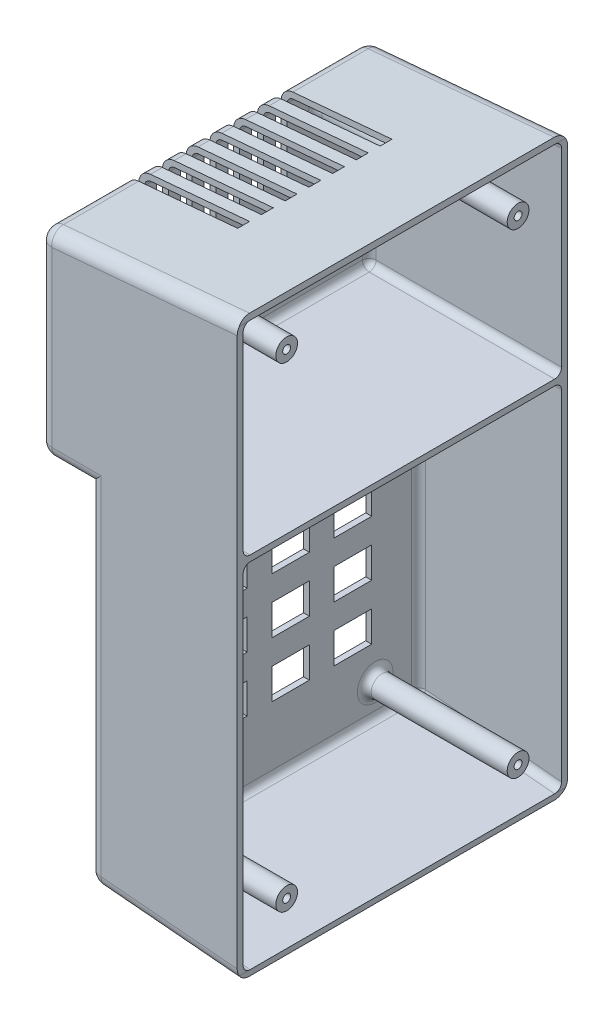
from build123d import *

# Parameters (mm, degrees)
BOSS_EXTRUDE1_DEPTH = 84.836
BOSS_EXTRUDE3_REACH = 154.288
SKETCH2_W           = 1.524
SKETCH2_H           = 147.477742188
CUT_EXTRUDE1_DEPTH  = 84.836
BOSS_EXTRUDE4_REACH = 154.288
SKETCH2_5_W         = 1.524
SKETCH2_5_H         = 147.477742188
CUT_EXTRUDE2_DEPTH  = 137.922
SKETCH5_R           = 2.794
SKETCH5_R_2         = 1.016
BOSS_EXTRUDE5_DEPTH = 36.708825352
SKETCH4_R           = 2.794
SKETCH4_R_2         = 1.016
BOSS_EXTRUDE6_DEPTH = 49.408825352
SKETCH6_W           = 9.652
SKETCH6_H           = 7.874
CUT_EXTRUDE3_DEPTH  = 137.922
FILLET1_R           = 3.302
FILLET2_R           = 1.778
SKETCH7_W           = 3.048
SKETCH7_H           = 35.859700712
CUT_EXTRUDE4_DEPTH  = 28.448


with BuildPart() as part:
    # Sketch1 → Boss-Extrude1 (new body)
    with BuildSketch(Plane.XY):
        Polygon((8.050273224, 31.718194599), (-42.749726776, 27.273770492), (-42.749726776, -23.526229508), (-30.049726776, -23.526229508), (-30.049726776, -112.426229508), (8.050273224, -115.759547589), (8.183098576, -114.241346869), (-28.525726776, -111.029740799), (-28.525726776, -23.526229508), (8.183098576, -23.526229508), (8.183098576, -22.002229508), (-28.525726776, -22.002229508), (-41.225726776, -22.002229508), (-41.225726776, 25.877281783), (8.183098576, 30.199993879), align=None)
    extrude(amount=BOSS_EXTRUDE1_DEPTH)

    # Boss-Extrude3: up to this face of the body (flat: up to its plane)
    boss_extrude3_end = Plane(part.part.faces().sort_by_distance((-41.225726776, 1.937526137, 42.418))[0])
    # Sketch2 → Boss-Extrude3 (add, up to the picked face)
    with BuildSketch(Plane(origin=(8.183098576, 0, 0), x_dir=(0, 0, -1), z_dir=(1, 0, 0)), mode=Mode.PRIVATE) as boss_extrude3_sk1:
        with Locations((-84.074, -42.020676495)):
            Rectangle(SKETCH2_W, SKETCH2_H)
    boss_extrude3_tool1 = split(extrude(boss_extrude3_sk1.sketch, amount=-BOSS_EXTRUDE3_REACH, mode=Mode.PRIVATE), bisect_by=boss_extrude3_end, keep=Keep.BOTH, mode=Mode.PRIVATE)
    add(boss_extrude3_tool1.solids().sort_by(Axis((8.183099, -42.020676, 84.074), (-1, 0, 0)))[0])

    # Sketch3 → Cut-Extrude1 (cut)
    with BuildSketch(Plane(origin=(0, 0, 83.312), x_dir=(-1, 0, 0), z_dir=(0, 0, -1))):
        Polygon((-8.050273224, -115.759547589), (30.049726776, -112.426229508), (30.049726776, -23.526229508), (42.749726776, -23.526229508), (42.749726776, 27.273770492), (-8.050273224, 31.718194599), (-8.183098576, 30.199993879), (-14.157128219, 30.722653748), (-14.157128219, 64.896442965), (63.943288286, 64.896442965), (63.943288286, -137.07668363), (-11.695133828, -137.07668363), (-11.695133828, -114.092888548), (-8.183098576, -114.241346869), align=None)
    extrude(amount=-CUT_EXTRUDE1_DEPTH, mode=Mode.SUBTRACT)

    # Boss-Extrude4: up to this face of the body (flat: up to its plane)
    boss_extrude4_end = Plane(part.part.faces().sort_by_distance((-41.225726776, 1.937526137, 41.656))[0])
    # Sketch2<5> → Boss-Extrude4 (add, up to the picked face)
    with BuildSketch(Plane(origin=(8.183098576, 0, 0), x_dir=(0, 0, -1), z_dir=(1, 0, 0)), mode=Mode.PRIVATE) as boss_extrude4_sk1:
        with Locations((-0.762, -42.020676495)):
            Rectangle(SKETCH2_5_W, SKETCH2_5_H)
    boss_extrude4_tool1 = split(extrude(boss_extrude4_sk1.sketch, amount=-BOSS_EXTRUDE4_REACH, mode=Mode.PRIVATE), bisect_by=boss_extrude4_end, keep=Keep.BOTH, mode=Mode.PRIVATE)
    add(boss_extrude4_tool1.solids().sort_by(Axis((8.183099, -42.020676, 0.762), (-1, 0, 0)))[0])

    # Sketch3<2> → Cut-Extrude2 (cut)
    with BuildSketch(Plane(origin=(0, 0, 83.312), x_dir=(-1, 0, 0), z_dir=(0, 0, -1))):
        Polygon((-8.050273224, -115.759547589), (30.049726776, -112.426229508), (30.049726776, -23.526229508), (42.749726776, -23.526229508), (42.749726776, 27.273770492), (-8.050273224, 31.718194599), (-8.183098576, 30.199993879), (-14.157128219, 30.722653748), (-14.157128219, 64.896442965), (63.943288286, 64.896442965), (63.943288286, -137.07668363), (-11.695133828, -137.07668363), (-11.695133828, -114.092888548), (-8.183098576, -114.241346869), align=None)
    extrude(amount=CUT_EXTRUDE2_DEPTH, mode=Mode.SUBTRACT)

    # Sketch5 → Boss-Extrude5 (add)
    # profile 1 of 2: a face of its own
    with BuildSketch(Plane(origin=(-28.525726776, 0, 0), x_dir=(0, 0, -1), z_dir=(1, 0, 0))):
        with Locations(Location((-72.136, -103.059547589, 0), (0, 0, 180))):
            Circle(SKETCH5_R)
        with Locations(Location((-72.136, -103.059547589, 0), (0, 0, 180))):
            Circle(SKETCH5_R_2, mode=Mode.SUBTRACT)
    # profile 2 of 2: a face of its own
    with BuildSketch(Plane(origin=(-28.525726776, 0, 0), x_dir=(0, 0, -1), z_dir=(1, 0, 0))):
        with Locations(Location((-12.7, -103.059547589, 0), (0, 0, 180))):
            Circle(SKETCH5_R)
        with Locations(Location((-12.7, -103.059547589, 0), (0, 0, 180))):
            Circle(SKETCH5_R_2, mode=Mode.SUBTRACT)
    extrude(amount=BOSS_EXTRUDE5_DEPTH)

    # Sketch4 → Boss-Extrude6 (add)
    # profile 1 of 2: a face of its own
    with BuildSketch(Plane(origin=(-41.225726776, 0, 0), x_dir=(0, 0, -1), z_dir=(1, 0, 0))):
        with Locations(Location((-12.7, 19.018194599, 0), (0, 0, 180))):
            Circle(SKETCH4_R)
        with Locations(Location((-12.7, 19.018194599, 0), (0, 0, 180))):
            Circle(SKETCH4_R_2, mode=Mode.SUBTRACT)
    # profile 2 of 2: a face of its own
    with BuildSketch(Plane(origin=(-41.225726776, 0, 0), x_dir=(0, 0, -1), z_dir=(1, 0, 0))):
        with Locations(Location((-72.136, 19.018194599, 0), (0, 0, 180))):
            Circle(SKETCH4_R)
        with Locations(Location((-72.136, 19.018194599, 0), (0, 0, 180))):
            Circle(SKETCH4_R_2, mode=Mode.SUBTRACT)
    extrude(amount=BOSS_EXTRUDE6_DEPTH)

    # Sketch6 → Cut-Extrude3 (cut)
    with BuildSketch(Plane(origin=(-28.525726776, 0, 0), x_dir=(0, 0, -1), z_dir=(1, 0, 0))):
        with Locations((-50.419, -90.232547589)):
            Rectangle(SKETCH6_W, SKETCH6_H)
        with Locations((-34.417, -90.232547589)):
            Rectangle(SKETCH6_W, SKETCH6_H)
        with Locations((-18.415, -90.232547589)):
            Rectangle(SKETCH6_W, SKETCH6_H)
        with Locations((-34.417, -76.008547589)):
            Rectangle(SKETCH6_W, SKETCH6_H)
        with Locations((-18.415, -76.008547589)):
            Rectangle(SKETCH6_W, SKETCH6_H)
        with Locations((-34.417, -61.784547589)):
            Rectangle(SKETCH6_W, SKETCH6_H)
        with Locations((-18.415, -61.784547589)):
            Rectangle(SKETCH6_W, SKETCH6_H)
        with Locations((-50.419, -76.008547589)):
            Rectangle(SKETCH6_W, SKETCH6_H)
        with Locations((-50.419, -61.784547589)):
            Rectangle(SKETCH6_W, SKETCH6_H)
        with Locations((-66.421, -90.232547589)):
            Rectangle(SKETCH6_W, SKETCH6_H)
        with Locations((-66.421, -76.008547589)):
            Rectangle(SKETCH6_W, SKETCH6_H)
        with Locations((-66.421, -61.784547589)):
            Rectangle(SKETCH6_W, SKETCH6_H)
    extrude(amount=-CUT_EXTRUDE3_DEPTH, mode=Mode.SUBTRACT)

    # Fillet1
    # the kernel refuses this fillet: 3.302 mm, written as the material it takes off along each edge
    with BuildSketch(Plane(origin=(-39.447726776, 24.248044955, 3.302), x_dir=(-1, 0, 0), z_dir=(0, 0, -1))) as fillet1_piece_1_section:
        Polygon((0, 0), (FILLET1_R * 1.02, 0), (FILLET1_R * 1.02, FILLET1_R * 0.934657797498), (FILLET1_R * 0.0888988576026, FILLET1_R * 1.01611859205), align=None)
    fillet1_piece_1 = extrude(amount=FILLET1_R * 1.02, mode=Mode.PRIVATE)
    fillet1_piece_1 = fillet1_piece_1 - Plane(origin=(-39.447726776, 24.248044955, 3.302), x_dir=(0.7372773368101218, -0.6755902076156627, 0), z_dir=(0, 0, -1)) * Sphere(FILLET1_R, mode=Mode.PRIVATE)
    add(fillet1_piece_1, mode=Mode.SUBTRACT)
    with BuildSketch(Plane(origin=(-26.747726776, -109.400503972, 3.302), x_dir=(-0.08715574274765817, -0.9961946980917455, 0), z_dir=(0, 0, -1))) as fillet1_piece_2_section:
        Polygon((0, 0), (FILLET1_R * 1.02, 0), (FILLET1_R * 1.02, FILLET1_R * 0.934657797498), (FILLET1_R * 0.0888988576026, FILLET1_R * 1.01611859205), align=None)
    fillet1_piece_2 = extrude(amount=FILLET1_R * 1.02, mode=Mode.PRIVATE)
    fillet1_piece_2 = fillet1_piece_2 - Plane(origin=(-26.747726776, -109.400503972, 3.302), x_dir=(0.737277336810124, 0.6755902076156602, 0), z_dir=(0, 0, -1)) * Sphere(FILLET1_R, mode=Mode.PRIVATE)
    add(fillet1_piece_2, mode=Mode.SUBTRACT)
    with BuildSketch(Plane(origin=(-26.747726776, -109.400503972, 81.534), x_dir=(-0.08715574274765817, -0.9961946980917455, 0), z_dir=(0, 0, 1))) as fillet1_piece_3_section:
        Polygon((0, 0), (FILLET1_R * 1.02, 0), (FILLET1_R * 1.02, -FILLET1_R * 0.934657797498), (FILLET1_R * 0.0888988576026, -FILLET1_R * 1.01611859205), align=None)
    fillet1_piece_3 = extrude(amount=FILLET1_R * 1.02, mode=Mode.PRIVATE)
    fillet1_piece_3 = fillet1_piece_3 - Plane(origin=(-26.747726776, -109.400503972, 81.534), x_dir=(0.737277336810124, 0.6755902076156602, 0), z_dir=(0, 0, 1)) * Sphere(FILLET1_R, mode=Mode.PRIVATE)
    add(fillet1_piece_3, mode=Mode.SUBTRACT)
    with BuildSketch(Plane(origin=(-39.447726776, -20.224229508, 3.302), x_dir=(0, 0, -1), z_dir=(0, -1, 0))) as fillet1_piece_4_section:
        Polygon((0, 0), (FILLET1_R * 1.02, 0), (FILLET1_R * 1.02, -FILLET1_R * 1.02), (0, -FILLET1_R * 1.02), align=None)
    fillet1_piece_4 = extrude(amount=FILLET1_R * 1.02, mode=Mode.PRIVATE)
    fillet1_piece_4 = fillet1_piece_4 - Plane(origin=(-39.447726776, -20.224229508, 3.302), x_dir=(0.7071067811865475, 0, 0.7071067811865475), z_dir=(0, -1, 0)) * Sphere(FILLET1_R, mode=Mode.PRIVATE)
    add(fillet1_piece_4, mode=Mode.SUBTRACT)
    with BuildSketch(Plane(origin=(-39.447726776, -20.224229508, 81.534), x_dir=(-1, 0, 0), z_dir=(0, -1, 0))) as fillet1_piece_5_section:
        Polygon((0, 0), (FILLET1_R * 1.02, 0), (FILLET1_R * 1.02, -FILLET1_R * 1.02), (0, -FILLET1_R * 1.02), align=None)
    fillet1_piece_5 = extrude(amount=FILLET1_R * 1.02, mode=Mode.PRIVATE)
    fillet1_piece_5 = fillet1_piece_5 - Plane(origin=(-39.447726776, -20.224229508, 81.534), x_dir=(0.7071067811865475, 0, -0.7071067811865475), z_dir=(0, -1, 0)) * Sphere(FILLET1_R, mode=Mode.PRIVATE)
    add(fillet1_piece_5, mode=Mode.SUBTRACT)
    with BuildSketch(Plane(origin=(-39.447726776, 24.248044955, 81.534), x_dir=(-1, 0, 0), z_dir=(0, 0, 1))) as fillet1_piece_6_section:
        Polygon((0, 0), (FILLET1_R * 1.02, 0), (FILLET1_R * 1.02, -FILLET1_R * 0.934657797498), (FILLET1_R * 0.0888988576026, -FILLET1_R * 1.01611859205), align=None)
    fillet1_piece_6 = extrude(amount=FILLET1_R * 1.02, mode=Mode.PRIVATE)
    fillet1_piece_6 = fillet1_piece_6 - Plane(origin=(-39.447726776, 24.248044955, 81.534), x_dir=(0.7372773368101218, -0.6755902076156627, 0), z_dir=(0, 0, 1)) * Sphere(FILLET1_R, mode=Mode.PRIVATE)
    add(fillet1_piece_6, mode=Mode.SUBTRACT)
    with BuildSketch(Plane(origin=(8.050273224, 31.718194599, 0), x_dir=(0, 0, 1), z_dir=(-0.9961946980917461, -0.08715574274765156, 0)), Plane(origin=(-39.735515039, 27.537479848, 84.836), x_dir=(0, 0, -1), z_dir=(0.9961946980917461, 0.08715574274765149, 0))) as fillet1_piece_7:
        with BuildLine():
            CenterArc((FILLET1_R, -FILLET1_R), FILLET1_R, 90, 90)
            Line((0, -FILLET1_R), (-FILLET1_R * 0.02, -FILLET1_R))
            Line((-FILLET1_R * 0.02, -FILLET1_R), (-FILLET1_R * 0.02, FILLET1_R * 0.02))
            Line((-FILLET1_R * 0.02, FILLET1_R * 0.02), (FILLET1_R, FILLET1_R * 0.02))
            Line((FILLET1_R, FILLET1_R * 0.02), (FILLET1_R, 0))
        make_face()
    extrude(amount=47.968322211, mode=Mode.SUBTRACT)
    with BuildSketch(Plane(origin=(8.050273224, -115.759547589, 0), x_dir=(0.08715574274765817, 0.9961946980917454, 0), z_dir=(-0.9961946980917455, 0.08715574274765817, 0))) as fillet1_piece_8:
        with BuildLine():
            CenterArc((FILLET1_R, -FILLET1_R), FILLET1_R, 90, 90)
            Line((0, -FILLET1_R), (-FILLET1_R * 0.02, -FILLET1_R))
            Line((-FILLET1_R * 0.02, -FILLET1_R), (-FILLET1_R * 0.02, FILLET1_R * 0.02))
            Line((-FILLET1_R * 0.02, FILLET1_R * 0.02), (FILLET1_R, FILLET1_R * 0.02))
            Line((FILLET1_R, FILLET1_R * 0.02), (FILLET1_R, 0))
        make_face()
    extrude(amount=35.219810274, mode=Mode.SUBTRACT)
    with BuildSketch(Plane(origin=(8.050273224, -115.759547589, 84.836), x_dir=(0.08715574274765817, 0.9961946980917457, -4.303711300788011e-15), z_dir=(-0.9961946980917455, 0.08715574274765817, 0))) as fillet1_piece_9:
        with BuildLine():
            CenterArc((FILLET1_R, FILLET1_R), FILLET1_R, 180, 90)
            Line((0, FILLET1_R), (-FILLET1_R * 0.02, FILLET1_R))
            Line((-FILLET1_R * 0.02, FILLET1_R), (-FILLET1_R * 0.02, -FILLET1_R * 0.02))
            Line((-FILLET1_R * 0.02, -FILLET1_R * 0.02), (FILLET1_R, -FILLET1_R * 0.02))
            Line((FILLET1_R, -FILLET1_R * 0.02), (FILLET1_R, 0))
        make_face()
    extrude(amount=35.219810274, mode=Mode.SUBTRACT)
    with BuildSketch(Plane(origin=(-30.049726776, -112.426229508, 81.534), x_dir=(0.9961946980917457, -0.08715574274765692, 0), z_dir=(0, 0, -1)), Plane(origin=(-42.749726776, 27.273770492, 3.302), x_dir=(0.9961946980917461, 0.08715574274765134, 0), z_dir=(0, 0, 1))) as fillet1_piece_10:
        with BuildLine():
            CenterArc((FILLET1_R * 0.916331174017, -FILLET1_R), FILLET1_R, 90, 85)
            Line((-FILLET1_R * 0.0798635240743, -FILLET1_R * 0.912844257252), (-FILLET1_R * 0.0997874180362, -FILLET1_R * 0.911101142397))
            Line((-FILLET1_R * 0.0997874180362, -FILLET1_R * 0.911101142397), (-FILLET1_R * 0.0183266234803, FILLET1_R * 0.02))
            Line((-FILLET1_R * 0.0183266234803, FILLET1_R * 0.02), (FILLET1_R * 0.916331174017, FILLET1_R * 0.02))
            Line((FILLET1_R * 0.916331174017, FILLET1_R * 0.02), (FILLET1_R * 0.916331174017, 0))
        make_face()
    extrude(amount=78.232, mode=Mode.SUBTRACT)
    with BuildSketch(Plane(origin=(-30.049726776, -109.400503972, 0), x_dir=(1, 0, 0), z_dir=(0, 1, 0))) as fillet1_piece_11:
        with BuildLine():
            CenterArc((FILLET1_R, -FILLET1_R), FILLET1_R, 90, 90)
            Line((0, -FILLET1_R), (-FILLET1_R * 0.02, -FILLET1_R))
            Line((-FILLET1_R * 0.02, -FILLET1_R), (-FILLET1_R * 0.02, FILLET1_R * 0.02))
            Line((-FILLET1_R * 0.02, FILLET1_R * 0.02), (FILLET1_R, FILLET1_R * 0.02))
            Line((FILLET1_R, FILLET1_R * 0.02), (FILLET1_R, 0))
        make_face()
    extrude(amount=85.874274463, mode=Mode.SUBTRACT)
    with BuildSketch(Plane(origin=(-39.447726776, -23.526229508, 0), x_dir=(0, 1, 0), z_dir=(1, 0, 0))) as fillet1_piece_12:
        with BuildLine():
            CenterArc((FILLET1_R, FILLET1_R), FILLET1_R, 180, 90)
            Line((0, FILLET1_R), (-FILLET1_R * 0.02, FILLET1_R))
            Line((-FILLET1_R * 0.02, FILLET1_R), (-FILLET1_R * 0.02, -FILLET1_R * 0.02))
            Line((-FILLET1_R * 0.02, -FILLET1_R * 0.02), (FILLET1_R, -FILLET1_R * 0.02))
            Line((FILLET1_R, -FILLET1_R * 0.02), (FILLET1_R, 0))
        make_face()
    extrude(amount=9.398, mode=Mode.SUBTRACT)
    with BuildSketch(Plane(origin=(-42.749726776, 24.248044955, 0), x_dir=(1, 0, 0), z_dir=(0, -1, 0))) as fillet1_piece_13:
        with BuildLine():
            CenterArc((FILLET1_R, FILLET1_R), FILLET1_R, 180, 90)
            Line((0, FILLET1_R), (-FILLET1_R * 0.02, FILLET1_R))
            Line((-FILLET1_R * 0.02, FILLET1_R), (-FILLET1_R * 0.02, -FILLET1_R * 0.02))
            Line((-FILLET1_R * 0.02, -FILLET1_R * 0.02), (FILLET1_R, -FILLET1_R * 0.02))
            Line((FILLET1_R, -FILLET1_R * 0.02), (FILLET1_R, 0))
        make_face()
    extrude(amount=44.472274463, mode=Mode.SUBTRACT)
    with BuildSketch(Plane(origin=(-42.749726776, -23.526229508, 3.302), x_dir=(0, 1, 0), z_dir=(0, 0, 1))) as fillet1_piece_14:
        with BuildLine():
            CenterArc((FILLET1_R, -FILLET1_R), FILLET1_R, 90, 90)
            Line((0, -FILLET1_R), (-FILLET1_R * 0.02, -FILLET1_R))
            Line((-FILLET1_R * 0.02, -FILLET1_R), (-FILLET1_R * 0.02, FILLET1_R * 0.02))
            Line((-FILLET1_R * 0.02, FILLET1_R * 0.02), (FILLET1_R, FILLET1_R * 0.02))
            Line((FILLET1_R, FILLET1_R * 0.02), (FILLET1_R, 0))
        make_face()
    extrude(amount=78.232, mode=Mode.SUBTRACT)
    with BuildSketch(Plane(origin=(-39.447726776, -23.526229508, 84.836), x_dir=(0, 1, 0), z_dir=(1, 0, 0))) as fillet1_piece_15:
        with BuildLine():
            CenterArc((FILLET1_R, -FILLET1_R), FILLET1_R, 90, 90)
            Line((0, -FILLET1_R), (-FILLET1_R * 0.02, -FILLET1_R))
            Line((-FILLET1_R * 0.02, -FILLET1_R), (-FILLET1_R * 0.02, FILLET1_R * 0.02))
            Line((-FILLET1_R * 0.02, FILLET1_R * 0.02), (FILLET1_R, FILLET1_R * 0.02))
            Line((FILLET1_R, FILLET1_R * 0.02), (FILLET1_R, 0))
        make_face()
    extrude(amount=9.398, mode=Mode.SUBTRACT)
    with BuildSketch(Plane(origin=(-30.049726776, -109.400503972, 84.836), x_dir=(1, 0, 0), z_dir=(0, 1, 0))) as fillet1_piece_16:
        with BuildLine():
            CenterArc((FILLET1_R, FILLET1_R), FILLET1_R, 180, 90)
            Line((0, FILLET1_R), (-FILLET1_R * 0.02, FILLET1_R))
            Line((-FILLET1_R * 0.02, FILLET1_R), (-FILLET1_R * 0.02, -FILLET1_R * 0.02))
            Line((-FILLET1_R * 0.02, -FILLET1_R * 0.02), (FILLET1_R, -FILLET1_R * 0.02))
            Line((FILLET1_R, -FILLET1_R * 0.02), (FILLET1_R, 0))
        make_face()
    extrude(amount=85.874274463, mode=Mode.SUBTRACT)
    with BuildSketch(Plane(origin=(-42.749726776, 24.248044955, 84.836), x_dir=(1, 0, 0), z_dir=(0, -1, 0))) as fillet1_piece_17:
        with BuildLine():
            CenterArc((FILLET1_R, -FILLET1_R), FILLET1_R, 90, 90)
            Line((0, -FILLET1_R), (-FILLET1_R * 0.02, -FILLET1_R))
            Line((-FILLET1_R * 0.02, -FILLET1_R), (-FILLET1_R * 0.02, FILLET1_R * 0.02))
            Line((-FILLET1_R * 0.02, FILLET1_R * 0.02), (FILLET1_R, FILLET1_R * 0.02))
            Line((FILLET1_R, FILLET1_R * 0.02), (FILLET1_R, 0))
        make_face()
    extrude(amount=44.472274463, mode=Mode.SUBTRACT)
    with BuildSketch(Plane(origin=(-39.447726776, -23.526229508, 0), x_dir=(0, 1, 0), z_dir=(1, 0, 0))) as fillet1_piece_18a_section:
        with BuildLine():
            CenterArc((FILLET1_R, FILLET1_R), FILLET1_R, 180, 90)
            Line((0, FILLET1_R), (-FILLET1_R * 0.02, FILLET1_R))
            Line((-FILLET1_R * 0.02, FILLET1_R), (-FILLET1_R * 0.02, -FILLET1_R * 0.02))
            Line((-FILLET1_R * 0.02, -FILLET1_R * 0.02), (FILLET1_R, -FILLET1_R * 0.02))
            Line((FILLET1_R, -FILLET1_R * 0.02), (FILLET1_R, 0))
        make_face()
    fillet1_piece_18a = extrude(amount=17.653, mode=Mode.PRIVATE)
    fillet1_piece_18a = split(fillet1_piece_18a, bisect_by=Plane(origin=(-30.049726776, -22.778672841, 0.747556667), z_dir=(1, 0, 0)), keep=Keep.TOP, mode=Mode.PRIVATE)
    with BuildSketch(Plane(origin=(-30.049726776, -109.400503972, 0), x_dir=(1, 0, 0), z_dir=(0, 1, 0))) as fillet1_piece_18b_section:
        with BuildLine():
            CenterArc((FILLET1_R, -FILLET1_R), FILLET1_R, 90, 90)
            Line((0, -FILLET1_R), (-FILLET1_R * 0.02, -FILLET1_R))
            Line((-FILLET1_R * 0.02, -FILLET1_R), (-FILLET1_R * 0.02, FILLET1_R * 0.02))
            Line((-FILLET1_R * 0.02, FILLET1_R * 0.02), (FILLET1_R, FILLET1_R * 0.02))
            Line((FILLET1_R, FILLET1_R * 0.02), (FILLET1_R, 0))
        make_face()
    fillet1_piece_18b = extrude(amount=94.129274463, mode=Mode.PRIVATE)
    fillet1_piece_18b = split(fillet1_piece_18b, bisect_by=Plane(origin=(-29.302170109, -23.526229508, 0.747556667), z_dir=(0, 1, 0)), keep=Keep.TOP, mode=Mode.PRIVATE)
    fillet1_piece_18 = fillet1_piece_18a & fillet1_piece_18b
    add(fillet1_piece_18, mode=Mode.SUBTRACT)
    with BuildSketch(Plane(origin=(-30.049726776, -109.400503972, 84.836), x_dir=(1, 0, 0), z_dir=(0, 1, 0))) as fillet1_piece_19a_section:
        with BuildLine():
            CenterArc((FILLET1_R, FILLET1_R), FILLET1_R, 180, 90)
            Line((0, FILLET1_R), (-FILLET1_R * 0.02, FILLET1_R))
            Line((-FILLET1_R * 0.02, FILLET1_R), (-FILLET1_R * 0.02, -FILLET1_R * 0.02))
            Line((-FILLET1_R * 0.02, -FILLET1_R * 0.02), (FILLET1_R, -FILLET1_R * 0.02))
            Line((FILLET1_R, -FILLET1_R * 0.02), (FILLET1_R, 0))
        make_face()
    fillet1_piece_19a = extrude(amount=94.129274463, mode=Mode.PRIVATE)
    fillet1_piece_19a = split(fillet1_piece_19a, bisect_by=Plane(origin=(-29.302170109, -23.526229508, 84.088443333), z_dir=(0, 1, 0)), keep=Keep.TOP, mode=Mode.PRIVATE)
    with BuildSketch(Plane(origin=(-39.447726776, -23.526229508, 84.836), x_dir=(0, 1, 0), z_dir=(1, 0, 0))) as fillet1_piece_19b_section:
        with BuildLine():
            CenterArc((FILLET1_R, -FILLET1_R), FILLET1_R, 90, 90)
            Line((0, -FILLET1_R), (-FILLET1_R * 0.02, -FILLET1_R))
            Line((-FILLET1_R * 0.02, -FILLET1_R), (-FILLET1_R * 0.02, FILLET1_R * 0.02))
            Line((-FILLET1_R * 0.02, FILLET1_R * 0.02), (FILLET1_R, FILLET1_R * 0.02))
            Line((FILLET1_R, FILLET1_R * 0.02), (FILLET1_R, 0))
        make_face()
    fillet1_piece_19b = extrude(amount=17.653, mode=Mode.PRIVATE)
    fillet1_piece_19b = split(fillet1_piece_19b, bisect_by=Plane(origin=(-30.049726776, -22.778672841, 84.088443333), z_dir=(1, 0, 0)), keep=Keep.TOP, mode=Mode.PRIVATE)
    fillet1_piece_19 = fillet1_piece_19a & fillet1_piece_19b
    add(fillet1_piece_19, mode=Mode.SUBTRACT)

    # Fillet2
    fillet2_edges = [part.edges().sort_by_distance(p)[0] for p in [
        (-10.1713141, -23.526229508, 1.524),
        (-28.525726776, -67.277985154, 1.524),
        (-10.1713141, -112.635543834, 1.524),
        (-16.5213141, -22.002229508, 1.524),
        (-16.5213141, 28.038637831, 1.524),
        (-41.225726776, 1.937526137, 1.524),
        (-28.525726776, -103.059547589, 69.342),
        (-28.525726776, -103.059547589, 9.906),
        (-41.225726776, 19.018194599, 9.906),
        (-41.225726776, 19.018194599, 69.342),
        (-41.225726776, 25.877281783, 42.418),
        (-41.225726776, -22.002229508, 42.418),
        (-28.525726776, -23.526229508, 42.418),
        (-28.525726776, -111.029740799, 42.418),
        (-16.5213141, -22.002229508, 83.312),
        (-28.525726776, -67.277985154, 83.312),
        (-10.1713141, -112.635543834, 83.312),
        (-10.1713141, -23.526229508, 83.312),
        (-16.5213141, 28.038637831, 83.312),
    ]]
    fillet(fillet2_edges, radius=FILLET2_R)

    # Sketch7 → Cut-Extrude4 (cut)
    with BuildSketch(Plane.ZY.offset(42.749726776)):
        with Locations((42.418, 24.248044955)):
            Rectangle(SKETCH7_W, SKETCH7_H)
        with Locations((48.514, 24.248044955)):
            Rectangle(SKETCH7_W, SKETCH7_H)
        with Locations((54.61, 24.248044955)):
            Rectangle(SKETCH7_W, SKETCH7_H)
        with Locations((60.706, 24.248044955)):
            Rectangle(SKETCH7_W, SKETCH7_H)
        with Locations((36.322, 24.248044955)):
            Rectangle(SKETCH7_W, SKETCH7_H)
        with Locations((30.226, 24.248044955)):
            Rectangle(SKETCH7_W, SKETCH7_H)
        with Locations((24.13, 24.248044955)):
            Rectangle(SKETCH7_W, SKETCH7_H)
    extrude(amount=-CUT_EXTRUDE4_DEPTH, mode=Mode.SUBTRACT)


solid = part.part
